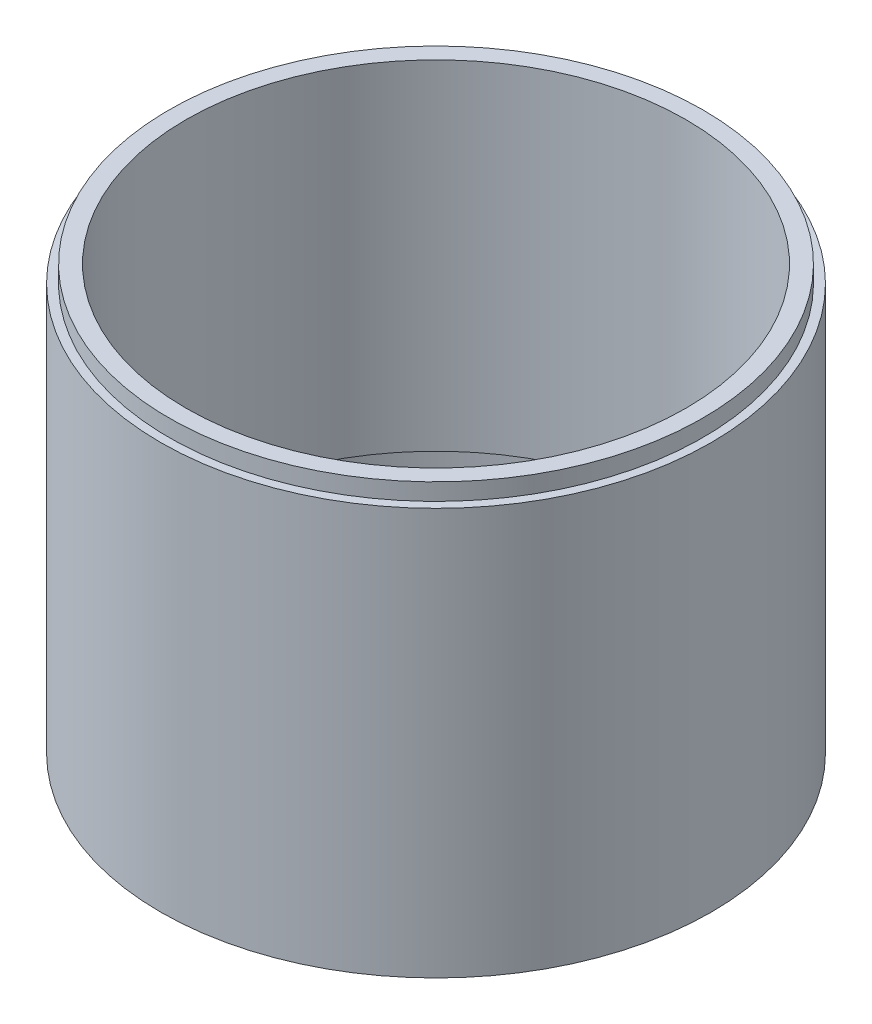
from build123d import *


with BuildPart() as part:
    # Szkic1 → Obrót1 (revolve)
    with BuildSketch(Plane.XY):
        Polygon((-65, 0), (-62, 0), (-62, 20), (-59, 20), (-59, 100), (-63, 100), (-63, 96), (-65, 96), (-65, 20), align=None)
    revolve(axis=Axis((0, 0, 0), (0, 1, 0)))


solid = part.part
